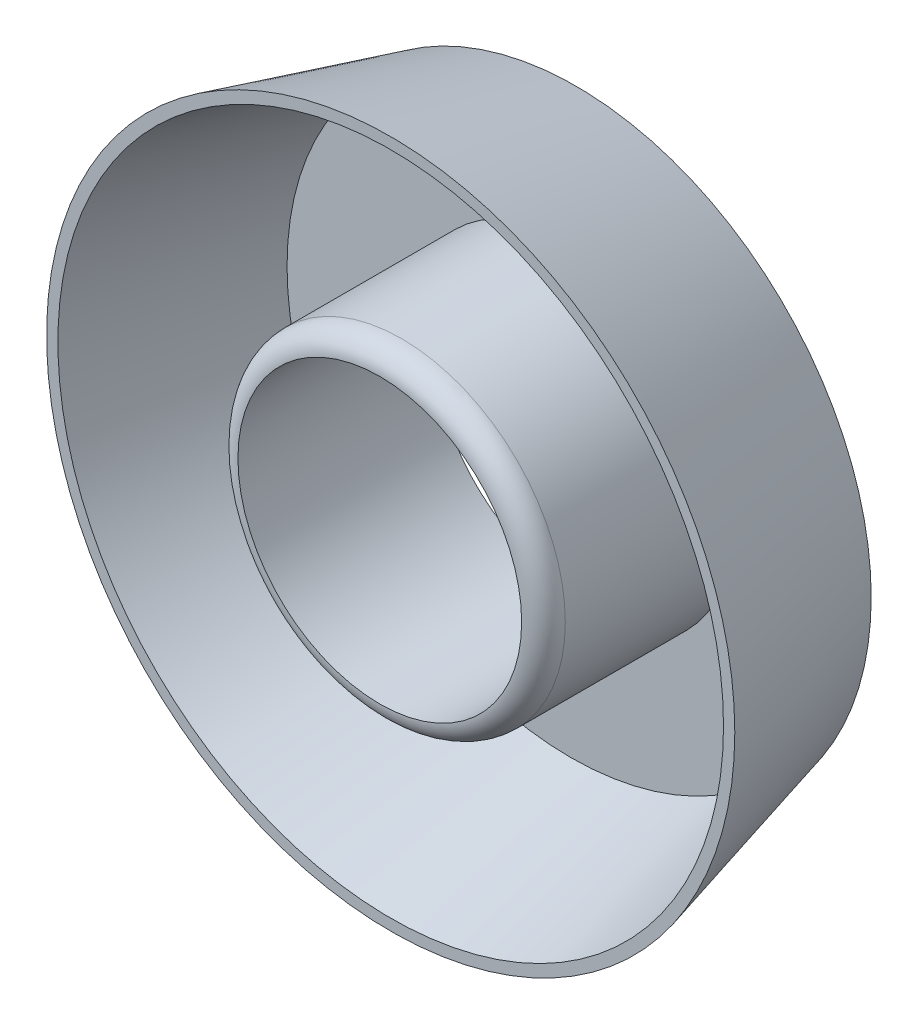
from build123d import *

# Parameters (mm, degrees)
SKETCH_1_R        = 26
SKETCH_1_R_2      = 13
EXTRUDE_1_DEPTH   = 0.5
SKETCH_7_R        = 15
SKETCH_7_R_2      = 13
EXTRUDE_1_2_DEPTH = 18
FILLET_4_R        = 2


# Read off the part's stored shape, not the designer's step: По сечениям-Тонкостенный1
with BuildPart() as part:
    # Эскиз1 → Extrude 1 (new body)
    with BuildSketch(Plane.XY):
        Circle(SKETCH_1_R)
        Circle(SKETCH_1_R_2, mode=Mode.SUBTRACT)
    extrude(amount=EXTRUDE_1_DEPTH)

    # Эскиз7 → Extrude 1 2 (add)
    with BuildSketch(Plane.XY):
        Circle(SKETCH_7_R)
        Circle(SKETCH_7_R_2, mode=Mode.SUBTRACT)
    extrude(amount=EXTRUDE_1_2_DEPTH)

    # Скругление4
    fillet_4_edges = [part.edges().sort_by_distance(p)[0] for p in [
        (-15, 0, 18),
    ]]
    fillet(fillet_4_edges, radius=FILLET_4_R - 0.0001)  # a hair under: the kernel refuses the full size


with BuildPart() as body_2:
    # По сечениям-Тонкостенный1 outline → По сечениям-Тонкостенный1 (revolve)
    with BuildSketch(Plane.XZ):
        Polygon((30.5, 17), (26, 0), (27.034441494, 0), (31.534441494, 17), align=None)
    revolve(axis=Axis((0, 0, 0), (0, 0, 1)))


solid = Compound([part.part, body_2.part])
